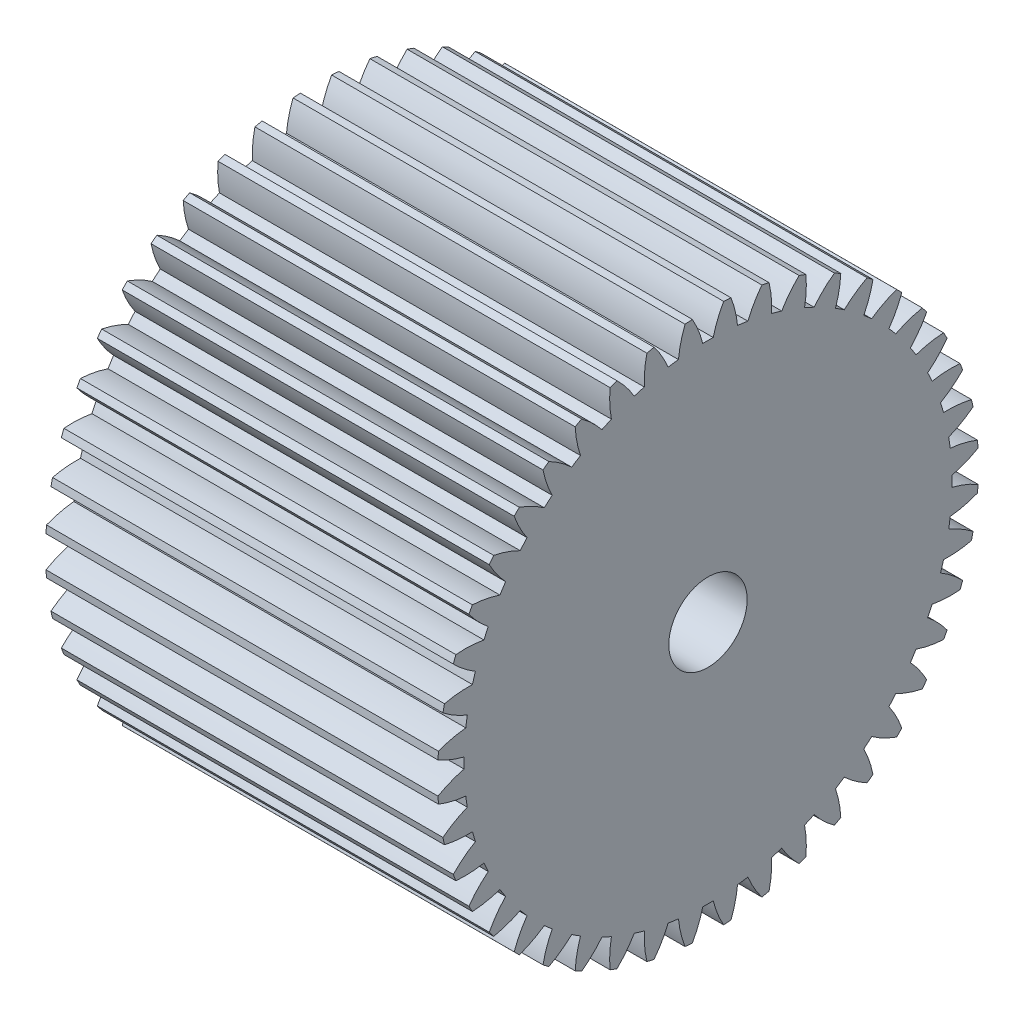
from build123d import *

# Parameters (mm, degrees)
BASPROSKE_W     = 20
BASPROSKE_H     = 13.8
TOOTHCUT_DEPTH  = 28.944230174
TEETHCUTS_COUNT = 44
TEETHCUTS_ANGLE = 351.818181818
BORSKE_R        = 2
BORE_DEPTH      = 50.0000508


with BuildPart() as part:
    # BasProSke → Base-Revolve (revolve)
    with BuildSketch(Plane(origin=(0, 0, 0), x_dir=(1, 0, 0), z_dir=(0, 1, 0))):
        with Locations((10, 6.9)):
            Rectangle(BASPROSKE_W, BASPROSKE_H)
    revolve(axis=Axis((-10, 0, 0), (1, 0, 0)))

    # TooCutSke → ToothCut (cut, through all)
    with BuildSketch(Plane(origin=(0, 0, 0), x_dir=(0, 0, -1), z_dir=(1, 0, 0))):
        with BuildLine():
            ThreePointArc((0.266454619, 12.446148116), (0, 12.449), (-0.266454619, 12.446148116))
            ThreePointArc((-0.266454619, 12.446148116), (-0.492086672, 13.142801738), (-0.8119348, 13.801537851))
            ThreePointArc((-0.8119348, 13.801537851), (0, 13.8254), (0.8119348, 13.801537851))
            ThreePointArc((0.8119348, 13.801537851), (0.492086672, 13.142801738), (0.266454619, 12.446148116))
        make_face()
    toothcut = extrude(amount=TOOTHCUT_DEPTH, mode=Mode.SUBTRACT)

    # TeethCuts: ToothCut ×44 about axis
    teethcuts_axis = Axis((-10, 0, 0), (1, 0, 0))
    for i in range(1, TEETHCUTS_COUNT):
        add(toothcut.rotate(teethcuts_axis, i * TEETHCUTS_ANGLE / (TEETHCUTS_COUNT - 1)), mode=Mode.SUBTRACT)

    # BorSke → Bore (cut, symmetric)
    with BuildSketch(Plane(origin=(0, 0, 0), x_dir=(0, 0, -1), z_dir=(1, 0, 0))):
        Circle(BORSKE_R)
    extrude(amount=BORE_DEPTH, both=True, mode=Mode.SUBTRACT)


solid = part.part
